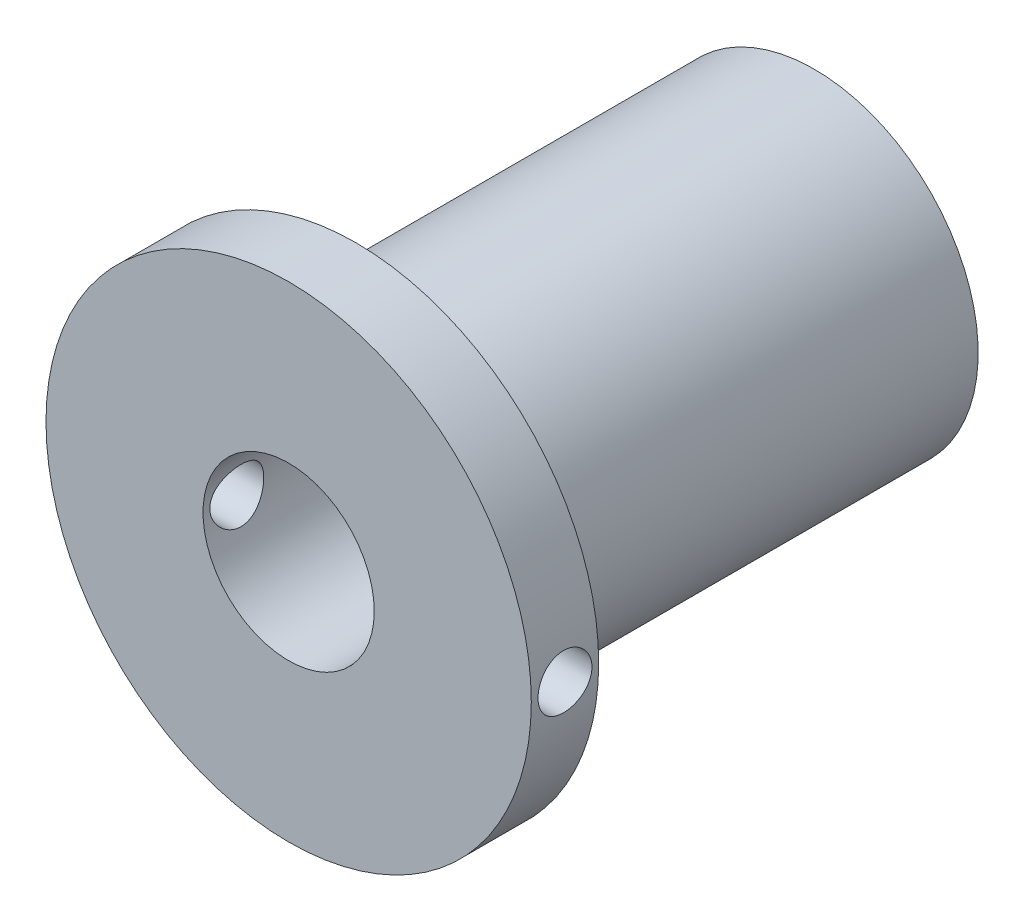
from build123d import *

# Parameters (mm, degrees)
BOSS_EXTRUDE1_DEPTH      = 6
BOSS_EXTRUDE1_DEPTH_BACK = 33
SKETCH1_R                = 18
SKETCH1_R_2              = 6.35
CUT_EXTRUDE1_OUTLINE_W   = 2
CUT_EXTRUDE1_OUTLINE_H   = 11.973288181
CIRPATTERN1_COUNT        = 2
SKETCH2_OUTSIDE_W        = 50.826
SKETCH2_OUTSIDE_H        = 50.826
SKETCH2_OUTSIDE_R        = 12.15
CUT_EXTRUDE2_DEPTH       = 34


# Read off the part's stored shape, not the designer's step: Cut-Extrude1
with BuildPart() as part:
    # Sketch1 → Boss-Extrude1 (new, two sides: drawn at the far end of the back side and taken through both)
    with BuildSketch(Plane.XY.offset(-BOSS_EXTRUDE1_DEPTH_BACK)):
        Circle(SKETCH1_R)
        Circle(SKETCH1_R_2, mode=Mode.SUBTRACT)
    extrude(amount=BOSS_EXTRUDE1_DEPTH + BOSS_EXTRUDE1_DEPTH_BACK)

    # Cut-Extrude1 outline → Cut-Extrude1 (revolve, cut)
    with BuildSketch(Plane.YX.offset(-3.5)):
        with Locations((1, -12.013415915)):
            Rectangle(CUT_EXTRUDE1_OUTLINE_W, CUT_EXTRUDE1_OUTLINE_H)
    cut_extrude1 = revolve(axis=Axis((0, 0, 3.5), (1, 0, 0)), mode=Mode.SUBTRACT)

    # CirPattern1: Cut-Extrude1 ×2 about axis
    cirpattern1_axis = Axis((0, 0, 6), (0, 0, 1))
    for i in range(1, CIRPATTERN1_COUNT):
        add(cut_extrude1.rotate(cirpattern1_axis, i * 360 / CIRPATTERN1_COUNT), mode=Mode.SUBTRACT)

    # Sketch2 outside → Cut-Extrude2 (cut)
    with BuildSketch(Plane(origin=(0, 0, -33), x_dir=(-1, 0, 0), z_dir=(0, 0, -1))):
        Rectangle(SKETCH2_OUTSIDE_W, SKETCH2_OUTSIDE_H)
        Circle(SKETCH2_OUTSIDE_R, mode=Mode.SUBTRACT)
    extrude(amount=-CUT_EXTRUDE2_DEPTH, mode=Mode.SUBTRACT)


solid = part.part
